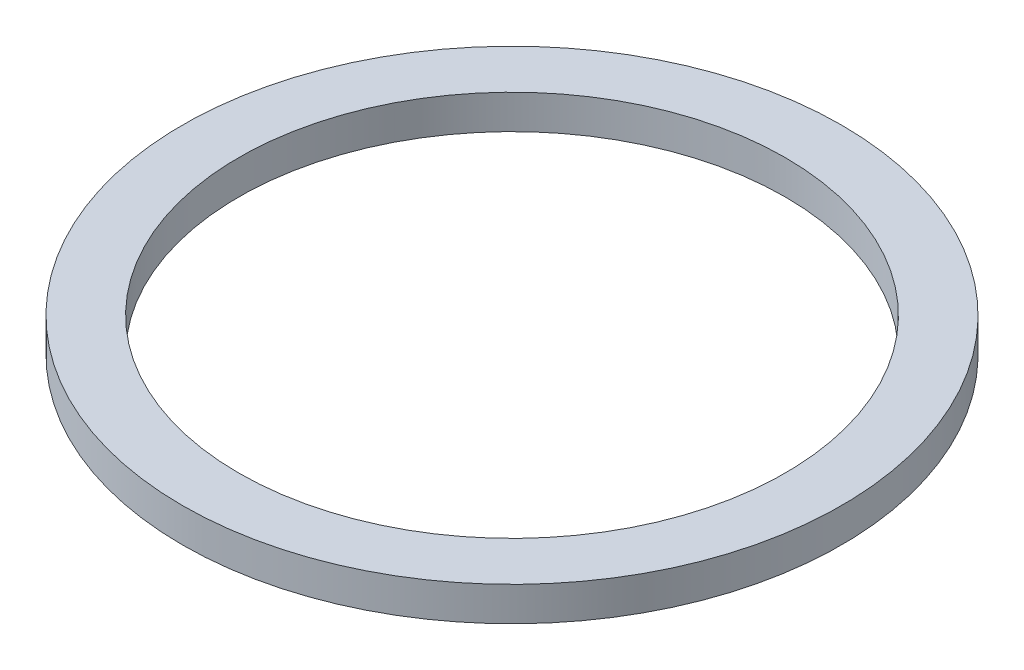
from build123d import *

# Parameters (mm, degrees)
SKETCH1_R           = 22.21
SKETCH1_R_2         = 18.415
BOSS_EXTRUDE1_DEPTH = 2.3


with BuildPart() as part:
    # Sketch1 → Boss-Extrude1 (new body)
    with BuildSketch(Plane(origin=(0, 0, 0), x_dir=(1, 0, 0), z_dir=(0, 1, 0))):
        Circle(SKETCH1_R)
        Circle(SKETCH1_R_2, mode=Mode.SUBTRACT)
    extrude(amount=BOSS_EXTRUDE1_DEPTH)


solid = part.part
